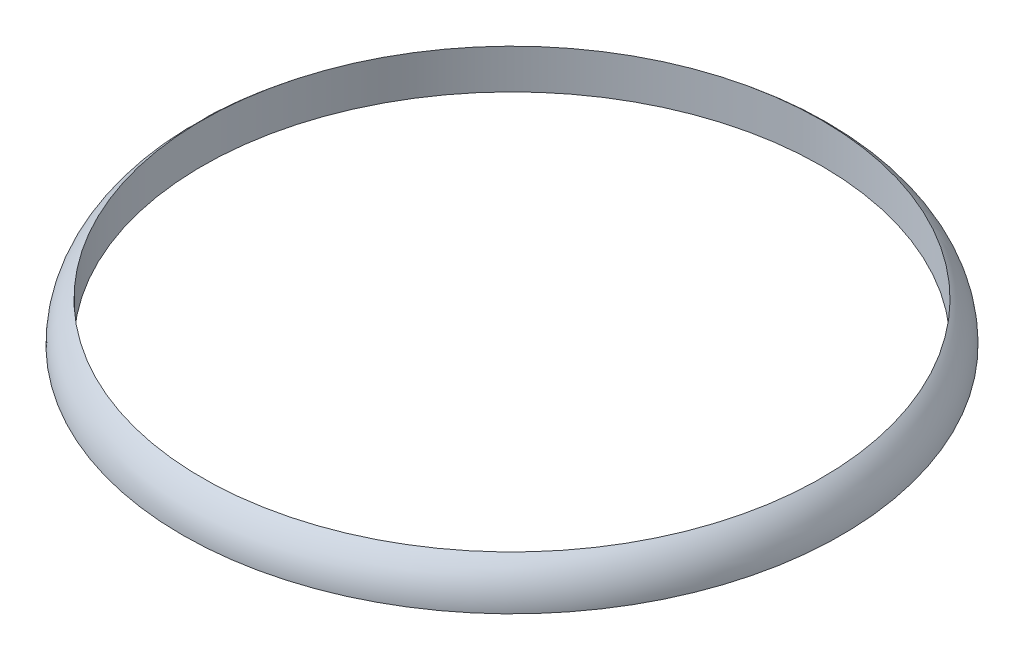
from build123d import *


with BuildPart() as part:
    # Sketch1 → Revolve1 (revolve)
    with BuildSketch(Plane(origin=(0, 0, 0), x_dir=(0, 0, -1), z_dir=(1, 0, 0))):
        with BuildLine():
            Line((78.2, 0), (78.2, 10))
            ThreePointArc((78.2, 10), (81.880339887, 5.590169944), (83.2, 0))
            Line((83.2, 0), (78.2, 0))
        make_face()
    revolve(axis=Axis((0, 0, 0), (0, 1, 0)))


solid = part.part
